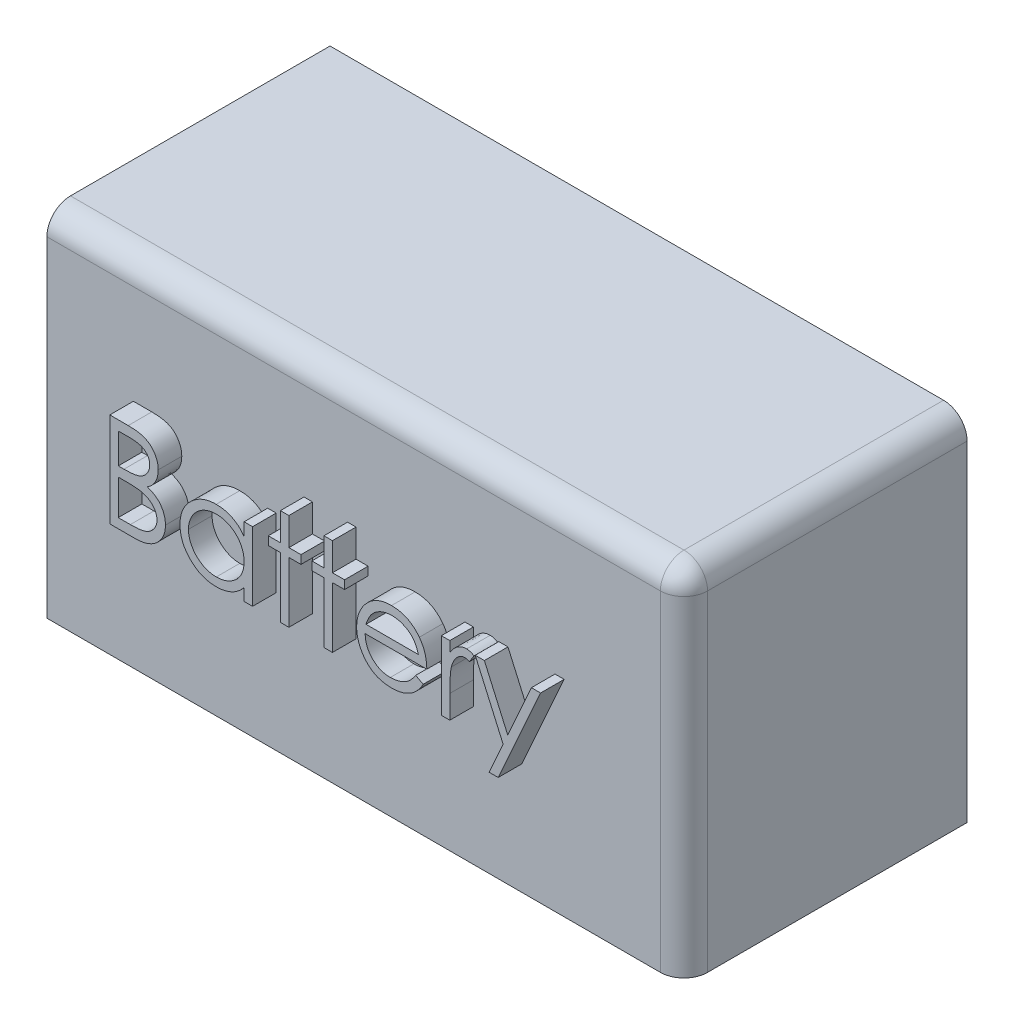
from build123d import *

# Parameters (mm, degrees)
SKETCH1_W           = 135
SKETCH1_H           = 75
BOSS_EXTRUDE1_DEPTH = 60
FILLET2_R           = 5
BOSS_EXTRUDE2_DEPTH = 5


with BuildPart() as part:
    # Sketch1 → Boss-Extrude1 (new body)
    with BuildSketch(Plane.XY):
        Rectangle(SKETCH1_W, SKETCH1_H)
    extrude(amount=BOSS_EXTRUDE1_DEPTH)

    # Fillet2
    fillet2_edges = [part.edges().sort_by_distance(p)[0] for p in [
        (67.5, 0, 60),
        (67.5, 37.5, 30),
        (0, 37.5, 60),
    ]]
    fillet(fillet2_edges, radius=FILLET2_R)

    # Sketch2 → Boss-Extrude2 (add)
    # profile 1 of 7: a face of its own
    with BuildSketch(Plane.XY.offset(60)):
        with BuildLine():
            Line((-49.168272795, 11.469638403), (-45.266029205, 11.469638403))
            add(Edge.make_bspline(
                [(-45.266029205, 11.469638403), (-45.075009329, 11.468634115), (-44.70476527, 11.466687555), (-44.16636846, 11.436498234), (-43.662089542, 11.395334406), (-43.191782271, 11.330019591), (-42.755663972, 11.251209436), (-42.352420331, 11.155770487), (-41.983333632, 11.041332695), (-41.542689424, 10.859353945), (-41.040285648, 10.58893584), (-40.496294832, 10.189344039), (-40.03112775, 9.700587107), (-39.63006308, 9.149257647), (-39.311199539, 8.542767523), (-39.08051784, 7.895572159), (-38.934472838, 7.216019348), (-38.919453214, 6.749486903), (-38.911862538, 6.513708916)],
                knots=[0, 0, 0, 0, 1.001505555, 1.941167018, 2.826882275, 3.653841531, 4.429895133, 5.150066043, 5.825578002, 6.45369114, 7.647487171, 8.808567382, 9.977351308, 11.170798116, 12.373658725, 13.556498008, 14.765093433, 16, 16, 16, 16], degree=3))
            add(Edge.make_bspline(
                [(-38.911862538, 6.513708916), (-38.918109501, 6.292837169), (-38.930385371, 5.858803358), (-39.047772567, 5.223979876), (-39.231547816, 4.619687197), (-39.487006382, 4.048130709), (-39.819017789, 3.522224348), (-40.212493896, 3.037725685), (-40.687218481, 2.615148216), (-41.042894138, 2.378903059), (-41.223561256, 2.258901224)],
                knots=[0, 0, 0, 0, 1.044552857, 2.05264487, 3.044412934, 4.028983338, 5.005914585, 5.980388656, 6.974128949, 8, 8, 8, 8], degree=3))
            add(Edge.make_bspline(
                [(-41.223561256, 2.258901224), (-40.996358813, 2.171672658), (-40.561664256, 2.004782804), (-39.963458471, 1.70972301), (-39.448059357, 1.388796665), (-39.011504237, 1.03832895), (-38.638146209, 0.660564317), (-38.3121294, 0.249963664), (-38.033950119, -0.198829238), (-37.795590555, -0.681135154), (-37.609597664, -1.192029259), (-37.470306782, -1.726719408), (-37.390492787, -2.283288295), (-37.379134837, -2.662061892), (-37.373401, -2.853278264)],
                knots=[0, 0, 0, 0, 1.27268992, 2.434971085, 3.483601985, 4.442670788, 5.356604649, 6.2567628, 7.179492994, 8.113709626, 9.066344395, 10.018646069, 10.999752585, 12, 12, 12, 12], degree=3))
            add(Edge.make_bspline(
                [(-37.373401, -2.853278264), (-37.378982977, -3.048517533), (-37.389965674, -3.432656265), (-37.470994084, -3.99697132), (-37.608188981, -4.536256729), (-37.79716696, -5.05400063), (-38.043808758, -5.549201398), (-38.343968554, -6.02242005), (-38.701863203, -6.468901939), (-39.102222455, -6.893608357), (-39.555149, -7.275481427), (-40.043810457, -7.61557118), (-40.574360856, -7.895262963), (-41.138086536, -8.130211657), (-41.7413112, -8.309681363), (-42.381326099, -8.435238928), (-43.057579252, -8.519839139), (-43.521634973, -8.526794596), (-43.759618948, -8.530361597)],
                knots=[0, 0, 0, 0, 0.978564426, 1.925352924, 2.850884081, 3.763762016, 4.682927383, 5.618979971, 6.567305752, 7.547517671, 8.540179244, 9.531824382, 10.526200242, 11.540722885, 12.589160233, 13.674978461, 14.80764778, 16, 16, 16, 16], degree=3))
            Line((-43.759618948, -8.530361597), (-49.168272795, -8.530361597))
            Line((-49.168272795, -8.530361597), (-49.168272795, 11.469638403))
        make_face()
        with BuildLine():
            Line((-47.373401, 9.418356352), (-47.373401, 3.008099941))
            Line((-47.373401, 3.008099941), (-46.167471512, 3.008099941))
            add(Edge.make_bspline(
                [(-46.167471512, 3.008099941), (-45.991192682, 3.010385216), (-45.650586058, 3.014800832), (-45.157329506, 3.0274495), (-44.699472259, 3.062866891), (-44.277804641, 3.098274103), (-43.892990676, 3.155843176), (-43.545882896, 3.224369592), (-43.23103377, 3.296843336), (-42.867950653, 3.420097546), (-42.456105233, 3.60225569), (-42.017058924, 3.884951897), (-41.630004812, 4.221662486), (-41.303163739, 4.610182268), (-41.035669622, 5.037989044), (-40.849876964, 5.498256932), (-40.723892483, 5.97951483), (-40.712512304, 6.309904846), (-40.706734333, 6.477651224)],
                knots=[0, 0, 0, 0, 1.156816544, 2.235205308, 3.236616184, 4.169592532, 5.011045266, 5.787822928, 6.49130361, 7.128639758, 8.301311294, 9.436451833, 10.541879658, 11.654887649, 12.756523258, 13.837046038, 14.901820046, 16, 16, 16, 16], degree=3))
            add(Edge.make_bspline(
                [(-40.706734333, 6.477651224), (-40.709741077, 6.588655632), (-40.715639133, 6.806402901), (-40.76394372, 7.123827782), (-40.846044145, 7.422363511), (-40.951497249, 7.706101284), (-41.098861185, 7.966169), (-41.272366689, 8.211558689), (-41.481999205, 8.433913652), (-41.720612421, 8.641739357), (-41.994947408, 8.825993801), (-42.304840504, 8.987369591), (-42.654484373, 9.117316886), (-43.037986402, 9.231123472), (-43.461249759, 9.311056579), (-43.919390064, 9.377647366), (-44.416159887, 9.411548749), (-44.759846187, 9.416036537), (-44.937503564, 9.418356352)],
                knots=[0, 0, 0, 0, 0.91205012, 1.789085906, 2.630437955, 3.453916878, 4.269457761, 5.079663411, 5.91843418, 6.774407191, 7.675494373, 8.627863946, 9.638891023, 10.736472738, 11.911756761, 13.175263542, 14.539845004, 16, 16, 16, 16], degree=3))
            Line((-44.937503564, 9.418356352), (-47.373401, 9.418356352))
        make_face(mode=Mode.SUBTRACT)
        with BuildLine():
            Line((-47.373401, 0.95681789), (-47.373401, -6.479079546))
            Line((-47.373401, -6.479079546), (-44.817311256, -6.479079546))
            add(Edge.make_bspline(
                [(-44.817311256, -6.479079546), (-44.634345965, -6.476886703), (-44.281704488, -6.472660289), (-43.772554601, -6.458862834), (-43.300651151, -6.427478402), (-42.868147518, -6.378073547), (-42.470373503, -6.324482408), (-42.112100914, -6.252417946), (-41.790425523, -6.169852457), (-41.417429479, -6.042228616), (-40.997409432, -5.843963068), (-40.544775967, -5.545024631), (-40.142340434, -5.188891444), (-39.800596096, -4.776714792), (-39.520521876, -4.328535781), (-39.316776418, -3.853419495), (-39.19111438, -3.359216481), (-39.175901984, -3.022263838), (-39.168272795, -2.853278264)],
                knots=[0, 0, 0, 0, 1.160039823, 2.235823828, 3.228722157, 4.157150951, 4.99529583, 5.772374946, 6.472645482, 7.099169577, 8.269452708, 9.405989375, 10.527446681, 11.663510218, 12.788923519, 13.866172445, 14.929861265, 16, 16, 16, 16], degree=3))
            add(Edge.make_bspline(
                [(-39.168272795, -2.853278264), (-39.169850534, -2.747602032), (-39.172980563, -2.537954136), (-39.220184077, -2.229863741), (-39.288834761, -1.931430179), (-39.377585812, -1.641843091), (-39.506839909, -1.366338083), (-39.657734452, -1.099466314), (-39.834656748, -0.840875003), (-40.110337695, -0.513947841), (-40.511320464, -0.137279195), (-41.081073467, 0.231506532), (-41.728915169, 0.528922572), (-42.198786557, 0.655205294), (-42.441509974, 0.720439685)],
                knots=[0, 0, 0, 0, 0.723448775, 1.435228256, 2.130040452, 2.821711965, 3.505591119, 4.210454504, 4.921174351, 5.648778258, 7.137944449, 8.670945889, 10.280296675, 12, 12, 12, 12], degree=3))
            add(Edge.make_bspline(
                [(-42.441509974, 0.720439685), (-42.538819093, 0.740183022), (-42.749805335, 0.782990649), (-43.093848652, 0.828177525), (-43.486625046, 0.86843501), (-43.929041487, 0.898213054), (-44.421657722, 0.928993303), (-44.965525829, 0.940963709), (-45.55842477, 0.955245196), (-45.969809755, 0.956280248), (-46.183497154, 0.95681789)],
                knots=[0, 0, 0, 0, 0.634451884, 1.375622551, 2.216452059, 3.157844607, 4.20941857, 5.370758133, 6.634282058, 8, 8, 8, 8], degree=3))
            Line((-46.183497154, 0.95681789), (-47.373401, 0.95681789))
        make_face(mode=Mode.SUBTRACT)
    # profile 2 of 7: a face of its own
    with BuildSketch(Plane.XY.offset(60)):
        with BuildLine():
            Line((-18.911862538, 6.085023018), (-18.911862538, -8.530361597))
            Line((-18.911862538, -8.530361597), (-20.706734333, -8.530361597))
            Line((-20.706734333, -8.530361597), (-20.706734333, -6.002316725))
            add(Edge.make_bspline(
                [(-20.706734333, -6.002316725), (-20.909127422, -6.231114405), (-21.304100081, -6.677615954), (-21.963763612, -7.260942654), (-22.663010343, -7.743104491), (-23.398446464, -8.132532581), (-24.169407854, -8.425058617), (-24.974185496, -8.632979527), (-25.813107672, -8.766658585), (-26.385978271, -8.780007281), (-26.676285615, -8.786771853)],
                knots=[0, 0, 0, 0, 1.074387032, 2.096679803, 3.090159297, 4.057316773, 5.018401886, 5.985159533, 6.978961417, 8, 8, 8, 8], degree=3))
            add(Edge.make_bspline(
                [(-26.676285615, -8.786771853), (-26.934388208, -8.779764012), (-27.443377951, -8.765944238), (-28.192115534, -8.658731075), (-28.912642674, -8.486556094), (-29.605640232, -8.247122439), (-30.26662392, -7.929517744), (-30.901253044, -7.549282041), (-31.506239856, -7.096477298), (-32.072362935, -6.578831422), (-32.593688652, -6.016574352), (-33.051181638, -5.416885513), (-33.432627809, -4.782358062), (-33.751599699, -4.121025754), (-33.997293095, -3.427797642), (-34.168571005, -2.705070968), (-34.275659272, -1.953700262), (-34.289473333, -1.442045845), (-34.296477923, -1.182605187)],
                knots=[0, 0, 0, 0, 1.033919861, 2.038935746, 3.024066025, 3.998881131, 4.97069526, 5.957263378, 6.95902576, 7.993208707, 9.027059324, 10.027763471, 11.009749337, 11.988697705, 12.965288445, 13.950418724, 14.960734635, 16, 16, 16, 16], degree=3))
            add(Edge.make_bspline(
                [(-34.296477923, -1.182605187), (-34.289318086, -0.928526881), (-34.275163476, -0.426227776), (-34.169716505, 0.312507641), (-33.992396456, 1.02404056), (-33.743551612, 1.706080235), (-33.424454726, 2.35945195), (-33.036294229, 2.984617808), (-32.579042088, 3.583300079), (-32.051885477, 4.141421375), (-31.480829647, 4.656967742), (-30.869922613, 5.10501943), (-30.234361006, 5.491972852), (-29.56428666, 5.798564145), (-28.86961749, 6.046616171), (-28.144169228, 6.218233132), (-27.390960207, 6.319360682), (-26.879585967, 6.334005048), (-26.620195871, 6.341433275)],
                knots=[0, 0, 0, 0, 1.020392517, 2.01726096, 2.990465484, 3.961182959, 4.928053699, 5.906110375, 6.912531644, 7.948652711, 8.985773172, 9.998621852, 10.987621588, 11.969261332, 12.953316658, 13.946091881, 14.958173133, 16, 16, 16, 16], degree=3))
            add(Edge.make_bspline(
                [(-26.620195871, 6.341433275), (-26.321910963, 6.333217552), (-25.736988334, 6.317106906), (-24.88139971, 6.183034179), (-24.072002693, 5.956528652), (-23.302549253, 5.648428664), (-22.575802475, 5.239007355), (-21.898642565, 4.722550434), (-21.26398266, 4.10231508), (-20.896095279, 3.625912541), (-20.706734333, 3.380696095)],
                knots=[0, 0, 0, 0, 1.038897134, 2.037228247, 3.008116434, 3.962042015, 4.918381754, 5.904844433, 6.921570401, 8, 8, 8, 8], degree=3))
            Line((-20.706734333, 3.380696095), (-20.706734333, 6.085023018))
            Line((-20.706734333, 6.085023018), (-18.911862538, 6.085023018))
        make_face()
        with BuildLine():
            add(Edge.make_bspline(
                [(-26.59615741, 4.54656148), (-26.858525055, 4.537226407), (-27.376397055, 4.518800458), (-28.136648495, 4.374951915), (-28.864153718, 4.135611375), (-29.555274143, 3.808286226), (-30.199092524, 3.396693445), (-30.774484928, 2.898856969), (-31.286157507, 2.328359745), (-31.716490446, 1.687776257), (-32.067293285, 1.001044308), (-32.313962039, 0.283190376), (-32.476643453, -0.452838067), (-32.493263571, -0.952053414), (-32.501606128, -1.202637238)],
                knots=[0, 0, 0, 0, 1.031046209, 2.035121221, 3.029706178, 4.034933723, 5.034054252, 6.02443088, 7.017295772, 8.038157696, 9.050218397, 10.03989886, 11.016116709, 12, 12, 12, 12], degree=3))
            add(Edge.make_bspline(
                [(-32.501606128, -1.202637238), (-32.490949595, -1.451723565), (-32.469678298, -1.948919884), (-32.316817187, -2.685951751), (-32.060360768, -3.403974849), (-31.710406124, -4.096894812), (-31.27219684, -4.740232528), (-30.764261682, -5.321604657), (-30.181688646, -5.821545161), (-29.536388606, -6.240045582), (-28.847200203, -6.57811713), (-28.122434881, -6.813349356), (-27.375716948, -6.965222388), (-26.867989326, -6.982962256), (-26.612183051, -6.991900059)],
                knots=[0, 0, 0, 0, 0.979072187, 1.954306742, 2.945804271, 3.96968567, 4.997920485, 5.998718438, 6.996577872, 8.005894225, 9.015743152, 10.005417472, 10.995077863, 12, 12, 12, 12], degree=3))
            add(Edge.make_bspline(
                [(-26.612183051, -6.991900059), (-26.352488749, -6.98241455), (-25.835982541, -6.963548815), (-25.073475639, -6.819084442), (-24.333504423, -6.580405595), (-23.626148832, -6.249553442), (-22.967199511, -5.839511408), (-22.375783068, -5.359470888), (-21.87569182, -4.801166979), (-21.451734051, -4.187587247), (-21.119303098, -3.514947267), (-20.877154188, -2.798751892), (-20.733989013, -2.038976188), (-20.715944843, -1.519753748), (-20.706734333, -1.254720571)],
                knots=[0, 0, 0, 0, 1.01762866, 2.023962475, 3.030623092, 4.058876274, 5.077231937, 6.066672613, 7.034107872, 8.005628644, 8.981990164, 9.965428785, 10.961468474, 12, 12, 12, 12], degree=3))
            add(Edge.make_bspline(
                [(-20.706734333, -1.254720571), (-20.712218084, -1.052790111), (-20.72301184, -0.655327064), (-20.805472238, -0.071741249), (-20.936643246, 0.486737186), (-21.121478503, 1.020695409), (-21.364285843, 1.527181211), (-21.657130219, 2.009831269), (-22.00516136, 2.466135334), (-22.402776767, 2.889810026), (-22.838006496, 3.276246953), (-23.298546728, 3.621185471), (-23.789853853, 3.904549887), (-24.303665493, 4.139071438), (-24.840873118, 4.325695152), (-25.405848089, 4.450196259), (-25.992585157, 4.535683808), (-26.39284833, 4.542897412), (-26.59615741, 4.54656148)],
                knots=[0, 0, 0, 0, 1.050140795, 2.067009409, 3.05949893, 4.030605086, 5.00011959, 5.97591094, 6.962425594, 7.979863591, 8.993523472, 9.986985069, 10.967611495, 11.937549037, 12.921786183, 13.919465291, 14.943216303, 16, 16, 16, 16], degree=3))
        make_face(mode=Mode.SUBTRACT)
    # profile 3 of 7: a face of its own
    with BuildSketch(Plane.XY.offset(60)):
        Polygon((-13.014426641, 11.982458916), (-11.219554846, 11.982458916), (-11.219554846, 6.085023018), (-8.655452282, 6.085023018), (-8.655452282, 4.290151224), (-11.219554846, 4.290151224), (-11.219554846, -8.530361597), (-13.014426641, -8.530361597), (-13.014426641, 4.290151224), (-15.578529205, 4.290151224), (-15.578529205, 6.085023018), (-13.014426641, 6.085023018), align=None)
    # profile 4 of 7: a face of its own
    with BuildSketch(Plane.XY.offset(60)):
        Polygon((-3.78365741, 11.982458916), (-1.988785615, 11.982458916), (-1.988785615, 6.085023018), (0.575316949, 6.085023018), (0.575316949, 4.290151224), (-1.988785615, 4.290151224), (-1.988785615, -8.530361597), (-3.78365741, -8.530361597), (-3.78365741, 4.290151224), (-6.347759974, 4.290151224), (-6.347759974, 6.085023018), (-3.78365741, 6.085023018), align=None)
    # profile 5 of 7: a face of its own
    with BuildSketch(Plane.XY.offset(60)):
        with BuildLine():
            Line((15.647432334, -3.914976982), (17.241983616, -4.752316725))
            add(Edge.make_bspline(
                [(17.241983616, -4.752316725), (17.114917357, -4.97770719), (16.867696737, -5.416227777), (16.442549606, -6.018695551), (15.99688062, -6.560682499), (15.510572232, -7.027709095), (14.998174066, -7.434859866), (14.45684461, -7.791076007), (13.883765652, -8.094610409), (13.278910082, -8.35033914), (12.637198361, -8.546964821), (11.95707541, -8.685846083), (11.237238294, -8.771693332), (10.743831551, -8.781665565), (10.491182334, -8.786771853)],
                knots=[0, 0, 0, 0, 1.120438281, 2.179929193, 3.190490725, 4.156257408, 5.095198341, 6.022838206, 6.959905092, 7.901321166, 8.864066838, 9.862729781, 10.905609505, 12, 12, 12, 12], degree=3))
            add(Edge.make_bspline(
                [(10.491182334, -8.786771853), (10.210371033, -8.780216566), (9.662589538, -8.767429099), (8.865219555, -8.657186445), (8.114480021, -8.477344395), (7.410413145, -8.22611273), (6.75474313, -7.897956592), (6.146166817, -7.498188124), (5.581483812, -7.028860955), (5.078488331, -6.485909849), (4.625666144, -5.904870093), (4.22609003, -5.299407896), (3.892047567, -4.671046613), (3.620318365, -4.023786476), (3.400861994, -3.361707084), (3.247909401, -2.678784412), (3.159739413, -1.976866788), (3.146228295, -1.50202487), (3.139419513, -1.262733392)],
                knots=[0, 0, 0, 0, 1.145258523, 2.234067595, 3.276747158, 4.290159414, 5.277019952, 6.260822364, 7.254936242, 8.264827045, 9.274100331, 10.257902744, 11.220704747, 12.172965371, 13.118907548, 14.062713208, 15.023725156, 16, 16, 16, 16], degree=3))
            add(Edge.make_bspline(
                [(3.139419513, -1.262733392), (3.145471749, -1.038191504), (3.157466482, -0.593179134), (3.233070982, 0.06548112), (3.367061228, 0.705643706), (3.550925936, 1.327840552), (3.788361628, 1.931029889), (4.078831453, 2.515578824), (4.422787897, 3.080865337), (4.688346033, 3.437454673), (4.822111821, 3.6170743)],
                knots=[0, 0, 0, 0, 1.024358464, 2.0301432, 3.019427413, 4.004406732, 4.986367066, 5.972626655, 6.978780325, 8, 8, 8, 8], degree=3))
            add(Edge.make_bspline(
                [(4.822111821, 3.6170743), (5.00329858, 3.833467844), (5.35993256, 4.259400132), (5.963111734, 4.819047708), (6.616255713, 5.28786928), (7.31117929, 5.676481487), (8.055959142, 5.97175947), (8.840583662, 6.191802797), (9.673987012, 6.315105717), (10.243731131, 6.332521909), (10.535252846, 6.341433275)],
                knots=[0, 0, 0, 0, 1.030682036, 2.02871468, 2.997146059, 3.962720338, 4.930598197, 5.918074684, 6.934738563, 8, 8, 8, 8], degree=3))
            add(Edge.make_bspline(
                [(10.535252846, 6.341433275), (10.834953448, 6.333695853), (11.422897711, 6.318516794), (12.280224117, 6.177794889), (13.091428211, 5.954637434), (13.856185379, 5.639472917), (14.574573154, 5.232846907), (15.241922009, 4.729179241), (15.869644938, 4.143933028), (16.234836817, 3.693857546), (16.420669513, 3.464830711)],
                knots=[0, 0, 0, 0, 1.056321875, 2.072262726, 3.055038591, 4.01806755, 4.982017516, 5.957941055, 6.960871419, 8, 8, 8, 8], degree=3))
            add(Edge.make_bspline(
                [(16.420669513, 3.464830711), (16.547109161, 3.292238817), (16.799146835, 2.948203853), (17.11484455, 2.387225813), (17.388886807, 1.800308131), (17.607932299, 1.177963576), (17.785300877, 0.527565975), (17.913625555, -0.155534281), (17.988880519, -0.871133774), (18.003673075, -1.358714091), (18.011214385, -1.607284674)],
                knots=[0, 0, 0, 0, 0.94817472, 1.890038105, 2.849395472, 3.817997239, 4.812318967, 5.836947057, 6.897266129, 8, 8, 8, 8], degree=3))
            Line((18.011214385, -1.607284674), (4.934291308, -1.607284674))
            add(Edge.make_bspline(
                [(4.934291308, -1.607284674), (4.943089059, -1.799858755), (4.960389482, -2.17854792), (5.041047443, -2.73266668), (5.168183293, -3.26051435), (5.346863651, -3.758131732), (5.563245624, -4.232018175), (5.828306862, -4.678658386), (6.144532885, -5.096017987), (6.497251167, -5.487830202), (6.88986314, -5.836748837), (7.30290741, -6.149044701), (7.74229921, -6.410790968), (8.204573973, -6.623247481), (8.688984174, -6.789569287), (9.195682432, -6.903099691), (9.723671668, -6.979140302), (10.083590148, -6.987595531), (10.266823359, -6.991900059)],
                knots=[0, 0, 0, 0, 1.094153842, 2.151609401, 3.174256925, 4.172055639, 5.149267565, 6.128595816, 7.11444997, 8.118368179, 9.117203808, 10.09244225, 11.054858984, 12.015122123, 12.976791628, 13.957293641, 14.960065497, 16, 16, 16, 16], degree=3))
            add(Edge.make_bspline(
                [(10.266823359, -6.991900059), (10.445972774, -6.988425449), (10.801439579, -6.981531157), (11.330815907, -6.914491666), (11.851613207, -6.806090091), (12.361675968, -6.658147291), (12.85065223, -6.477708136), (13.303483945, -6.259977521), (13.71994232, -6.019121825), (14.109182129, -5.743637968), (14.486730663, -5.406448328), (14.861259156, -4.985672779), (15.262840033, -4.488029763), (15.514209134, -4.113483101), (15.647432334, -3.914976982)],
                knots=[0, 0, 0, 0, 0.99110716, 1.966546729, 2.947904876, 3.932708344, 4.903319531, 5.828989031, 6.710028674, 7.56322171, 8.463672341, 9.504779593, 10.677557249, 12, 12, 12, 12], degree=3))
        make_face()
        with BuildLine():
            add(Edge.make_bspline(
                [(16.21634259, 0.187587121), (16.150647593, 0.425660685), (16.02420587, 0.88387566), (15.759998073, 1.518395034), (15.462446412, 2.082325897), (15.110322233, 2.571352371), (14.711358086, 3.00565816), (14.250528471, 3.385192932), (13.733751937, 3.724721224), (13.163699704, 4.011306935), (12.560032361, 4.255248985), (11.927996978, 4.418821075), (11.283095333, 4.530875603), (10.846899411, 4.541310508), (10.627400282, 4.54656148)],
                knots=[0, 0, 0, 0, 1.154881502, 2.222775134, 3.210006277, 4.132804581, 5.035138423, 5.962687519, 6.919655026, 7.923214229, 8.944639381, 9.960483929, 10.97369054, 12, 12, 12, 12], degree=3))
            add(Edge.make_bspline(
                [(10.627400282, 4.54656148), (10.448260634, 4.543066214), (10.094139211, 4.536156808), (9.572418821, 4.470613212), (9.07139197, 4.362271241), (8.587361755, 4.213900061), (8.126671079, 4.016136618), (7.679843832, 3.784232466), (7.258241567, 3.501137701), (6.994577022, 3.285372816), (6.861374641, 3.176369172)],
                knots=[0, 0, 0, 0, 1.04873581, 2.073130211, 3.073294108, 4.04793562, 5.032784715, 6.005352987, 6.992311501, 8, 8, 8, 8], degree=3))
            add(Edge.make_bspline(
                [(6.861374641, 3.176369172), (6.765984459, 3.09011594), (6.572937977, 2.91556042), (6.31499214, 2.614822097), (6.068018011, 2.290527456), (5.843254281, 1.930269601), (5.637096644, 1.538150864), (5.444182488, 1.117478662), (5.270545848, 0.665060775), (5.172853791, 0.349789694), (5.12259259, 0.187587121)],
                knots=[0, 0, 0, 0, 0.879870761, 1.780643979, 2.707998968, 3.669668524, 4.684282772, 5.740141944, 6.837334558, 8, 8, 8, 8], degree=3))
            Line((5.12259259, 0.187587121), (16.21634259, 0.187587121))
        make_face(mode=Mode.SUBTRACT)
    # profile 6 of 7: a face of its own
    with BuildSketch(Plane.XY.offset(60)):
        with BuildLine():
            Line((21.088137462, 6.085023018), (22.883009257, 6.085023018))
            Line((22.883009257, 6.085023018), (22.883009257, 3.933580711))
            add(Edge.make_bspline(
                [(22.883009257, 3.933580711), (23.01551645, 4.13389973), (23.268935426, 4.517008297), (23.690152166, 5.023690017), (24.121599773, 5.443204569), (24.5653437, 5.777510391), (25.024647128, 6.02787107), (25.48942971, 6.211259841), (25.967003823, 6.319701643), (26.287929104, 6.334179694), (26.448714385, 6.341433275)],
                knots=[0, 0, 0, 0, 1.2804753, 2.448899062, 3.506932113, 4.484331642, 5.4025378, 6.288909075, 7.142734305, 8, 8, 8, 8], degree=3))
            add(Edge.make_bspline(
                [(26.448714385, 6.341433275), (26.573436251, 6.334630266), (26.830059595, 6.320632632), (27.218531536, 6.222285063), (27.618779833, 6.065267791), (27.876736332, 5.917609376), (28.011214385, 5.840631993)],
                knots=[0, 0, 0, 0, 0.901110191, 1.854092781, 2.881294221, 4, 4, 4, 4], degree=3))
            Line((28.011214385, 5.840631993), (27.025637462, 4.286144813))
            add(Edge.make_bspline(
                [(27.025637462, 4.286144813), (26.939300198, 4.32466062), (26.775415544, 4.397770993), (26.535675165, 4.484296766), (26.314638955, 4.535244856), (26.173818622, 4.542963242), (26.108169513, 4.54656148)],
                knots=[0, 0, 0, 0, 1.180555205, 2.24091978, 3.179933427, 4, 4, 4, 4], degree=3))
            add(Edge.make_bspline(
                [(26.108169513, 4.54656148), (25.96413675, 4.536961266), (25.670351665, 4.517379614), (25.239011668, 4.363443569), (24.820456208, 4.114727911), (24.488046709, 3.838892987), (24.230662407, 3.572905573), (24.047003975, 3.340628986), (23.878531136, 3.080179663), (23.717558448, 2.796010042), (23.570893909, 2.483268064), (23.434010085, 2.145078273), (23.310245154, 1.781048966), (23.23967233, 1.527434565), (23.203522077, 1.397523018)],
                knots=[0, 0, 0, 0, 1.125678352, 2.296057538, 3.5422874, 4.923748041, 5.663163013, 6.437101912, 7.23742474, 8.08941207, 8.991984279, 9.93940061, 10.944477711, 12, 12, 12, 12], degree=3))
            add(Edge.make_bspline(
                [(23.203522077, 1.397523018), (23.176479829, 1.281653455), (23.116583305, 1.025011177), (23.058345946, 0.594448179), (23.000805844, 0.085741557), (22.960253739, -0.502524688), (22.922664927, -1.16888151), (22.901464457, -1.914344057), (22.883732225, -2.739677492), (22.883257557, -3.316673796), (22.883009257, -3.618502623)],
                knots=[0, 0, 0, 0, 0.566838948, 1.255505196, 2.06880316, 3.007127437, 4.065329342, 5.249902469, 6.561414163, 8, 8, 8, 8], degree=3))
            Line((22.883009257, -3.618502623), (22.883009257, -8.530361597))
            Line((22.883009257, -8.530361597), (21.088137462, -8.530361597))
            Line((21.088137462, -8.530361597), (21.088137462, 6.085023018))
        make_face()
    # profile 7 of 7: a face of its own
    with BuildSketch(Plane.XY.offset(60)):
        Polygon((28.267624641, 6.085023018), (30.202720795, 6.085023018), (35.150637462, -5.108887238), (40.174675923, 6.085023018), (42.113778488, 6.085023018), (33.139419513, -13.914976982), (31.200316949, -13.914976982), (34.17707977, -7.284368007), align=None)
    extrude(amount=BOSS_EXTRUDE2_DEPTH)


solid = part.part
